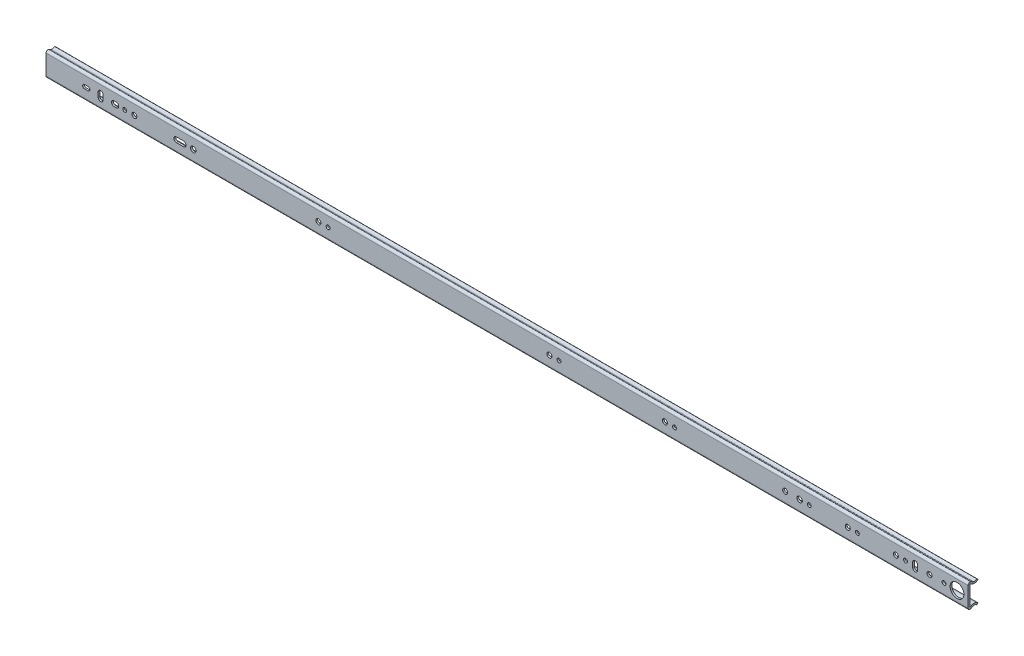
from build123d import *
from build123d.topology import SkipClean

# Parameters (mm, degrees)
EXTRUDE_THIN1_START     = -609.6
EXTRUDE_THIN1_DEPTH     = 1219.2
EXTRUDE_THIN2_DEPTH     = 1212.85
EXTRUDE_THIN5_START     = -1216.66
EXTRUDE_THIN5_DEPTH     = 1216.66
CUT_EXTRUDE1_DEPTH      = 1830.230661576
CUT_EXTRUDE1_DEPTH_BACK = 1830.230661576
SKETCH6_W               = 12.7
SKETCH6_H               = 12.7
SKETCH9_W               = 2.3622
SKETCH9_H               = 13.3858
EXTRUDE1_DEPTH          = 25.4
FILLET1_R               = 1.016
FILLET2_R               = 3.3782
CUT_EXTRUDE2_DEPTH      = 2.3622
SKETCH2_R               = 2.5781
SKETCH2_R_2             = 3.302
CUT_EXTRUDE12_DEPTH     = 2.3622
SKETCH22_R              = 2.5781
SKETCH22_R_2            = 3.302
SKETCH22_R_3            = 3.5687
CUT_EXTRUDE13_DEPTH     = 2.3622
SKETCH23_R              = 2.5781
SKETCH23_R_2            = 3.302
CUT_EXTRUDE14_DEPTH     = 2.3622
SKETCH24_R              = 2.5781
SKETCH24_R_2            = 3.302
CUT_EXTRUDE15_DEPTH     = 2.3622
SKETCH25_R              = 2.5781
SKETCH25_R_2            = 3.302
CUT_EXTRUDE16_DEPTH     = 2.3622
SKETCH27_R              = 3.5687
CUT_E_DEPTH             = 2.3622
SKETCH28_R              = 3.302
CUT_F_DEPTH             = 2.3622
SKETCH29_R              = 2.5781
CUT_EXTRUDE18_DEPTH     = 2.3622
CUT_H_DEPTH             = 2.3622
CUT_J_DEPTH             = 2.3622
SKETCH32_R              = 2.5781
SKETCH32_R_2            = 3.302
CUT_EXTRUDE21_DEPTH     = 2.3622
SKETCH210_R             = 2.5781
SKETCH210_R_2           = 3.302
CUT_EXTRUDE19_DEPTH     = 2.3622
SKETCH211_R             = 2.5781
SKETCH211_R_2           = 3.302
CUT_EXTRUDE110_DEPTH    = 2.3622
SKETCH212_R             = 2.5781
SKETCH212_R_2           = 3.302
CUT_EXTRUDE111_DEPTH    = 2.3622
SKETCH214_R             = 2.5781
SKETCH214_R_2           = 3.302
CUT_EXTRUDE113_DEPTH    = 2.3622
SKETCH215_R             = 3.302
CUT_EXTRUDE114_DEPTH    = 2.3622
CUT_R_DEPTH             = 2.3622
LPATTERN1_COUNT         = 23
LPATTERN1_PITCH         = 25.4
EXTRUDE2_DEPTH          = 12.7
EXTRUDE2_DEPTH_BACK     = 565.15
SKETCH218_W             = 11.43
SKETCH218_H             = 1.27
LPATTERN2_COUNT         = 23
LPATTERN2_PITCH         = 25.4
EXTRUDE3_DEPTH          = 12.7
EXTRUDE3_DEPTH_BACK     = 568.96
SKETCH220_W             = 9.245599771
SKETCH220_H             = 1.27


# Read off the part's stored shape, not the designer's step: Extrude-Thin1, Extrude-Thin5
with BuildPart() as part:
    # Extrude-Thin1 outline → Extrude-Thin1 (new body)
    with BuildSketch(Plane(origin=(0, 0, 0), x_dir=(0, 0, -1), z_dir=(1, 0, 0)).offset(EXTRUDE_THIN1_START)):
        with BuildLine():
            ThreePointArc((5.752462483, 35.334775085), (-0.647910774, 38.071449668), (-6.469678085, 34.255536805))
            Line((-6.469678085, 34.255536805), (-4.394919251, 33.126216382))
            ThreePointArc((-4.394919251, 33.126216382), (-0.440132491, 35.718405464), (3.907707273, 33.85935411))
            ThreePointArc((3.907707273, 33.85935411), (4.993998236, 32.994951487), (6.347544809, 32.686517335))
            Line((6.347544809, 32.686517335), (7.175193262, 32.686517335))
            ThreePointArc((7.175193262, 32.686517335), (8.297725277, 32.22154935), (8.762693262, 31.099017335))
            Line((8.762693262, 31.099017335), (8.762693262, 0))
            Line((8.762693262, 0), (11.124893262, 0))
            Line((11.124893262, 0), (11.124893262, 31.099017335))
            ThreePointArc((11.124893262, 31.099017335), (9.968052916, 33.891876989), (7.175193262, 35.048717335))
            Line((7.175193262, 35.048717335), (6.347544809, 35.048717335))
            ThreePointArc((6.347544809, 35.048717335), (6.017411498, 35.123945177), (5.752462483, 35.334775085))
        make_face()
    extrude(amount=EXTRUDE_THIN1_DEPTH)

    # Sketch6 → Cut-Extrude1 (cut, two sides: drawn at the far end of the back side and taken through both)
    with BuildSketch(Plane.XY.offset(-CUT_EXTRUDE1_DEPTH_BACK)):
        with Locations((-603.25, 31.75)):
            Rectangle(SKETCH6_W, SKETCH6_H)
    extrude(amount=CUT_EXTRUDE1_DEPTH + CUT_EXTRUDE1_DEPTH_BACK, mode=Mode.SUBTRACT)

    # Sketch9 → Extrude1 (add)
    with BuildSketch(Plane(origin=(0, 25.4, 0), x_dir=(-1, 0, 0), z_dir=(0, 1, 0))):
        with Locations((608.4189, -2.069793262)):
            Rectangle(SKETCH9_W, SKETCH9_H)
    extrude(amount=-EXTRUDE1_DEPTH)

    # Fillet1
    fillet1_edges = [part.edges().sort_by_distance(p)[0] for p in [
        (-607.2378, 12.7, -8.762693262),
    ]]
    fillet(fillet1_edges, radius=FILLET1_R)

    # Fillet2
    fillet2_edges = [part.edges().sort_by_distance(p)[0] for p in [
        (-609.6, 12.7, -11.124893262),
    ]]
    fillet(fillet2_edges, radius=FILLET2_R)

    # Sketch32 → Cut-Extrude21 (cut)
    with BuildSketch(Plane.XY.offset(-8.762693262)):
        with Locations((596.9, 0)):
            Circle(SKETCH32_R)
        with Locations((577.85, 0)):
            Circle(SKETCH32_R_2)
        with Locations((520.7, 0)):
            Circle(SKETCH32_R_2)
        with Locations((533.4, 0)):
            Circle(SKETCH32_R)
        with BuildLine():
            Line((549.148, 0), (561.848, 0))
            ThreePointArc((561.848, 0), (560.880866591, 2.334866591), (558.546, 3.302))
            Line((558.546, 3.302), (552.45, 3.302))
            ThreePointArc((552.45, 3.302), (550.115133409, 2.334866591), (549.148, 0))
        make_face()
    extrude(amount=-CUT_EXTRUDE21_DEPTH, mode=Mode.SUBTRACT)

    # Sketch210 → Cut-Extrude19 (cut)
    with BuildSketch(Plane(origin=(-677.249248887, 14.903736783, -8.762693262), x_dir=(1, 0, 0), z_dir=(0, 0, 1))):
        with Locations((1051.899248887, -14.903736783)):
            Circle(SKETCH210_R)
        with Locations((1039.199248887, -14.903736783)):
            Circle(SKETCH210_R_2)
    extrude(amount=-CUT_EXTRUDE19_DEPTH, mode=Mode.SUBTRACT)

    # Sketch211 → Cut-Extrude110 (cut)
    with BuildSketch(Plane(origin=(-447.985498291, 15.81613418, -8.762693262), x_dir=(1, 0, 0), z_dir=(0, 0, 1))):
        with Locations((460.685498291, -15.81613418)):
            Circle(SKETCH211_R)
        with Locations((447.985498291, -15.81613418)):
            Circle(SKETCH211_R_2)
    extrude(amount=-CUT_EXTRUDE110_DEPTH, mode=Mode.SUBTRACT)

    # Sketch212 → Cut-Extrude111 (cut)
    with BuildSketch(Plane(origin=(250.194594693, 14.477181682, -8.762693262), x_dir=(1, 0, 0), z_dir=(0, 0, 1))):
        with Locations((-599.444594693, -14.477181682)):
            Circle(SKETCH212_R)
        with Locations((-612.144594693, -14.477181682)):
            Circle(SKETCH212_R_2)
    extrude(amount=-CUT_EXTRUDE111_DEPTH, mode=Mode.SUBTRACT)

    # Sketch214 → Cut-Extrude113 (cut)
    with BuildSketch(Plane(origin=(529.798432462, 18.139402612, -8.762693262), x_dir=(1, 0, 0), z_dir=(0, 0, 1))):
        with Locations((-1066.500432462, -18.139402612)):
            Circle(SKETCH214_R)
        with Locations((-1079.200432462, -18.139402612)):
            Circle(SKETCH214_R_2)
        with BuildLine():
            Line((-1044.148432462, -18.139402612), (-1056.848432462, -18.139402612))
            ThreePointArc((-1056.848432462, -18.139402612), (-1055.881299054, -15.80453602), (-1053.546432462, -14.837402612))
            Line((-1053.546432462, -14.837402612), (-1047.450432462, -14.837402612))
            ThreePointArc((-1047.450432462, -14.837402612), (-1045.115565871, -15.80453602), (-1044.148432462, -18.139402612))
        make_face()
    extrude(amount=-CUT_EXTRUDE113_DEPTH, mode=Mode.SUBTRACT)

    # Sketch215 → Cut-Extrude114 (cut)
    with BuildSketch(Plane(origin=(674.3557152, 11.320285871, -8.762693262), x_dir=(1, 0, 0), z_dir=(0, 0, 1))):
        with Locations((-1252.2057152, -11.320285871)):
            Circle(SKETCH215_R)
    extrude(amount=-CUT_EXTRUDE114_DEPTH, mode=Mode.SUBTRACT)

    # Sketch216 → Cut R (cut)
    with BuildSketch(Plane.XY.offset(-8.762693262)):
        with BuildLine():
            Line((-601.6625, 0), (-592.1375, 0))
            ThreePointArc((-592.1375, 0), (-592.892608007, 1.822991993), (-594.7156, 2.5781))
            Line((-594.7156, 2.5781), (-599.0844, 2.5781))
            ThreePointArc((-599.0844, 2.5781), (-600.907391993, 1.822991993), (-601.6625, 0))
        make_face()
    extrude(amount=-CUT_R_DEPTH, mode=Mode.SUBTRACT)

    # Mirror1 3: part across plane


with BuildPart() as body_2:
    # Sketch4 → Extrude-Thin2 (new body)
    with BuildSketch(Plane(origin=(1219.2, 0, 0), x_dir=(0, 0, -1), z_dir=(1, 0, 0))):
        with BuildLine():
            ThreePointArc((3.54024831, 19.789205828), (0.77024158, 21.457292879), (-2.36668079, 20.672965307))
            ThreePointArc((-2.36668079, 20.672965307), (-3.091811244, 20.294053258), (-3.898522237, 20.157649845))
            ThreePointArc((-3.898522237, 20.157649845), (-5.766174756, 20.914093138), (-6.542172842, 22.773705828))
            Line((-6.542172842, 22.773705828), (-6.542172842, 25.161305828))
            ThreePointArc((-6.542172842, 25.161305828), (-5.766174756, 27.020918518), (-3.898522237, 27.77736181))
            ThreePointArc((-3.898522237, 27.77736181), (-3.659975019, 27.729624759), (-3.455361804, 27.598030559))
            ThreePointArc((-3.455361804, 27.598030559), (-0.023095262, 26.226172038), (3.414460302, 27.584723163))
            ThreePointArc((3.414460302, 27.584723163), (6.244879756, 28.080225918), (7.822893148, 25.678836527))
            Line((7.822893148, 25.678836527), (7.822893148, 11.408756936))
            ThreePointArc((7.822893148, 11.408756936), (7.431553352, 9.948256936), (6.362393148, 8.879096732))
            Line((6.362393148, 8.879096732), (3.123893148, 7.009347885))
            ThreePointArc((3.123893148, 7.009347885), (2.84498179, 6.730436527), (2.742893148, 6.349436527))
            Line((2.742893148, 6.349436527), (2.742893148, 0))
            Line((2.742893148, 0), (0.583893148, 0))
            Line((0.583893148, 0), (0.583893148, 6.349436527))
            ThreePointArc((0.583893148, 6.349436527), (0.975232943, 7.809936527), (2.044393148, 8.879096732))
            Line((2.044393148, 8.879096732), (5.282893148, 10.748845578))
            ThreePointArc((5.282893148, 10.748845578), (5.561804505, 11.027756936), (5.663893148, 11.408756936))
            Line((5.663893148, 11.408756936), (5.663893148, 25.678836527))
            ThreePointArc((5.663893148, 25.678836527), (5.388123817, 26.098496809), (4.893487408, 26.011904095))
            ThreePointArc((4.893487408, 26.011904095), (0.412345154, 24.079826794), (-4.266408016, 25.466487303))
            ThreePointArc((-4.266408016, 25.466487303), (-4.352985021, 25.324684037), (-4.383172842, 25.161305828))
            Line((-4.383172842, 25.161305828), (-4.383172842, 22.773705828))
            ThreePointArc((-4.383172842, 22.773705828), (-4.247561526, 22.448724969), (-3.921175649, 22.316530996))
            ThreePointArc((-3.921175649, 22.316530996), (-3.780197029, 22.340368486), (-3.653475202, 22.406586125))
            ThreePointArc((-3.653475202, 22.406586125), (1.089702598, 23.592527212), (5.278086268, 21.070299201))
            Line((5.278086268, 21.070299201), (3.54024831, 19.789205828))
        make_face()
    extrude(amount=-EXTRUDE_THIN2_DEPTH)

    # Mirror1: body 2 across plane


with BuildPart() as body_3:
    # Extrude-Thin5 outline → Extrude-Thin5 (new body)
    with BuildSketch(Plane(origin=(1828.8, 0, 0), x_dir=(0, 0, -1), z_dir=(1, 0, 0)).offset(EXTRUDE_THIN5_START)):
        with BuildLine():
            Line((-7.925106738, 0), (-5.562906738, 0))
            Line((-5.562906738, 0), (-5.562906738, 13.036209579))
            ThreePointArc((-5.562906738, 13.036209579), (-5.437890097, 13.255022954), (-5.185904431, 13.258440163))
            Line((-5.185904431, 13.258440163), (-2.932066495, 12.010964405))
            ThreePointArc((-2.932066495, 12.010964405), (1.369676528, 11.28348431), (5.180595526, 13.407423274))
            Line((5.180595526, 13.407423274), (3.41147618, 14.972736527))
            ThreePointArc((3.41147618, 14.972736527), (0.968956668, 13.611447462), (-1.788145038, 14.077708835))
            Line((-1.788145038, 14.077708835), (-4.041982973, 15.325184593))
            ThreePointArc((-4.041982973, 15.325184593), (-6.637435339, 15.28998734), (-7.925106738, 13.036209579))
            Line((-7.925106738, 13.036209579), (-7.925106738, 0))
        make_face()
    extrude(amount=EXTRUDE_THIN5_DEPTH)

    # Sketch10 → Cut-Extrude2 (cut)
    with BuildSketch(Plane.XY.offset(7.925106738)):
        with BuildLine():
            Line((1805.07005, 0), (1823.35805, 0))
            ThreePointArc((1823.35805, 0), (1814.21405, 9.144), (1805.07005, 0))
        make_face()
        with BuildLine():
            Line((1799.6281, 0), (1794.4719, 0))
            ThreePointArc((1794.4719, 0), (1797.05, 2.5781), (1799.6281, 0))
        make_face()
        with BuildLine():
            Line((1781.302, 0), (1774.698, 0))
            ThreePointArc((1774.698, 0), (1778, 3.302), (1781.302, 0))
        make_face()
        with BuildLine():
            Line((1762.252, 3.048), (1762.252, 0))
            Line((1762.252, 0), (1755.648, 0))
            Line((1755.648, 0), (1755.648, 3.048))
            ThreePointArc((1755.648, 3.048), (1758.95, 6.35), (1762.252, 3.048))
        make_face()
        with BuildLine():
            Line((1748.8281, 0), (1743.6719, 0))
            ThreePointArc((1743.6719, 0), (1746.25, 2.5781), (1748.8281, 0))
        make_face()
        with BuildLine():
            Line((1736.852, 0), (1730.248, 0))
            ThreePointArc((1730.248, 0), (1733.55, 3.302), (1736.852, 0))
        make_face()
    extrude(amount=-CUT_EXTRUDE2_DEPTH, mode=Mode.SUBTRACT)

    # Sketch2 → Cut-Extrude12 (cut)
    with BuildSketch(Plane(origin=(-2141.845428582, 6.157941778, 7.925106738), x_dir=(1, 0, 0), z_dir=(0, 0, 1))):
        with Locations((3824.595428582, -6.157941778)):
            Circle(SKETCH2_R)
        with Locations((3811.895428582, -6.157941778)):
            Circle(SKETCH2_R_2)
    extrude(amount=-CUT_EXTRUDE12_DEPTH, mode=Mode.SUBTRACT)

    # Sketch22 → Cut-Extrude13 (cut)
    with BuildSketch(Plane(origin=(-2143.135428603, 5.657950018, 7.925106738), x_dir=(1, 0, 0), z_dir=(0, 0, 1))):
        with Locations((3762.385428603, -5.657950018)):
            Circle(SKETCH22_R)
        with Locations((3730.635428603, -5.657950018)):
            Circle(SKETCH22_R_2)
        with Locations((3749.685428603, -5.657950018)):
            Circle(SKETCH22_R_3)
    extrude(amount=-CUT_EXTRUDE13_DEPTH, mode=Mode.SUBTRACT)

    # Sketch23 → Cut-Extrude14 (cut)
    with BuildSketch(Plane(origin=(-2022.429166167, 5.760053708, 7.925106738), x_dir=(1, 0, 0), z_dir=(0, 0, 1))):
        with Locations((3463.879166167, -5.760053708)):
            Circle(SKETCH23_R)
        with Locations((3451.179166167, -5.760053708)):
            Circle(SKETCH23_R_2)
    extrude(amount=-CUT_EXTRUDE14_DEPTH, mode=Mode.SUBTRACT)

    # Sketch24 → Cut-Extrude15 (cut)
    with BuildSketch(Plane(origin=(-1862.330020924, 7.905664942, 7.925106738), x_dir=(1, 0, 0), z_dir=(0, 0, 1))):
        with Locations((3151.380020924, -7.905664942)):
            Circle(SKETCH24_R)
        with Locations((3138.680020924, -7.905664942)):
            Circle(SKETCH24_R_2)
    extrude(amount=-CUT_EXTRUDE15_DEPTH, mode=Mode.SUBTRACT)

    # Sketch25 → Cut-Extrude16 (cut)
    with BuildSketch(Plane(origin=(-1718.369763818, 7.737387679, 7.925106738), x_dir=(1, 0, 0), z_dir=(0, 0, 1))):
        with Locations((2702.619763818, -7.737387679)):
            Circle(SKETCH25_R)
        with Locations((2689.919763818, -7.737387679)):
            Circle(SKETCH25_R_2)
    extrude(amount=-CUT_EXTRUDE16_DEPTH, mode=Mode.SUBTRACT)

    # Sketch27 → Cut E (cut)
    with BuildSketch(Plane.XY.offset(7.925106738)):
        with Locations((806.45, 0)):
            Circle(SKETCH27_R)
        with BuildLine():
            Line((796.8615, 0), (780.9865, 0))
            ThreePointArc((780.9865, 0), (781.953633409, 2.334866591), (784.2885, 3.302))
            Line((784.2885, 3.302), (793.5595, 3.302))
            ThreePointArc((793.5595, 3.302), (795.894366591, 2.334866591), (796.8615, 0))
        make_face()
    extrude(amount=-CUT_E_DEPTH, mode=Mode.SUBTRACT)

    # Sketch28 → Cut F (cut)
    with BuildSketch(Plane.XY.offset(7.925106738)):
        with Locations((728.726, 0)):
            Circle(SKETCH28_R)
    extrude(amount=-CUT_F_DEPTH, mode=Mode.SUBTRACT)

    # Sketch29 → Cut-Extrude18 (cut)
    with BuildSketch(Plane(origin=(-866.129297637, 5.417355799, 7.925106738), x_dir=(1, 0, 0), z_dir=(0, 0, 1))):
        with Locations((1582.155297637, -5.417355799)):
            Circle(SKETCH29_R)
        with BuildLine():
            Line((1574.217797637, -5.417355799), (1564.692797637, -5.417355799))
            ThreePointArc((1564.692797637, -5.417355799), (1565.659931046, -3.082489207), (1567.994797637, -2.115355799))
            Line((1567.994797637, -2.115355799), (1570.915797637, -2.115355799))
            ThreePointArc((1570.915797637, -2.115355799), (1573.250664228, -3.082489207), (1574.217797637, -5.417355799))
        make_face()
    extrude(amount=-CUT_EXTRUDE18_DEPTH, mode=Mode.SUBTRACT)

    # Sketch30 → Cut H (cut)
    with BuildSketch(Plane.XY.offset(7.925106738)):
        with BuildLine():
            Line((680.974, 0), (680.974, 3.048))
            ThreePointArc((680.974, 3.048), (684.276, 6.35), (687.578, 3.048))
            Line((687.578, 3.048), (687.578, 0))
            Line((687.578, 0), (680.974, 0))
        make_face()
    extrude(amount=-CUT_H_DEPTH, mode=Mode.SUBTRACT)

    # Sketch31 → Cut J (cut)
    with BuildSketch(Plane.XY.offset(7.925106738)):
        with BuildLine():
            Line((669.9885, 0), (660.4635, 0))
            ThreePointArc((660.4635, 0), (661.218608007, 1.822991993), (663.0416, 2.5781))
            Line((663.0416, 2.5781), (667.4104, 2.5781))
            ThreePointArc((667.4104, 2.5781), (669.233391993, 1.822991993), (669.9885, 0))
        make_face()
    extrude(amount=-CUT_J_DEPTH, mode=Mode.SUBTRACT)

    # Mirror1 2: body 3 across plane


with BuildPart() as body_2_1:
    add(body_2.part)
    add(body_2.part.mirror(Plane.ZX))


with BuildPart() as body_3_1:
    with SkipClean():  # the faces are left unmerged after this step: merging them gives an invalid solid
        add(body_3.part)
        add(body_3.part.mirror(Plane.ZX))


with BuildPart() as part_1:
    with SkipClean():  # the faces are left unmerged after this step: merging them gives an invalid solid
        add(part.part)
        add(part.part.mirror(Plane.ZX))


with BuildPart() as body_4:
    # Sketch217 → Revolve1 (revolve)
    with BuildSketch(Plane(origin=(584.2, 0, 0), x_dir=(0, 0, -1), z_dir=(1, 0, 0))):
        with BuildLine():
            Line((0, 35.7378), (0, 26.22652483))
            ThreePointArc((0, 26.22652483), (4.755637585, 30.982162415), (0, 35.7378))
        make_face()
    revolve(axis=Axis((584.2, 36.603094088, 0), (0, -1, 0)))


with BuildPart() as lpattern1_1:
    # LPattern1: pattern copy
    add(body_4.part.moved(Location(Vector(-1, 0, 0) * (1 * LPATTERN1_PITCH))))


with BuildPart() as lpattern1_2:
    # LPattern1: pattern copy
    add(body_4.part.moved(Location(Vector(-1, 0, 0) * (2 * LPATTERN1_PITCH))))


with BuildPart() as lpattern1_3:
    # LPattern1: pattern copy
    add(body_4.part.moved(Location(Vector(-1, 0, 0) * (3 * LPATTERN1_PITCH))))


with BuildPart() as lpattern1_4:
    # LPattern1: pattern copy
    add(body_4.part.moved(Location(Vector(-1, 0, 0) * (4 * LPATTERN1_PITCH))))


with BuildPart() as lpattern1_5:
    # LPattern1: pattern copy
    add(body_4.part.moved(Location(Vector(-1, 0, 0) * (5 * LPATTERN1_PITCH))))


with BuildPart() as lpattern1_6:
    # LPattern1: pattern copy
    add(body_4.part.moved(Location(Vector(-1, 0, 0) * (6 * LPATTERN1_PITCH))))


with BuildPart() as lpattern1_7:
    # LPattern1: pattern copy
    add(body_4.part.moved(Location(Vector(-1, 0, 0) * (7 * LPATTERN1_PITCH))))


with BuildPart() as lpattern1_8:
    # LPattern1: pattern copy
    add(body_4.part.moved(Location(Vector(-1, 0, 0) * (8 * LPATTERN1_PITCH))))


with BuildPart() as lpattern1_9:
    # LPattern1: pattern copy
    add(body_4.part.moved(Location(Vector(-1, 0, 0) * (9 * LPATTERN1_PITCH))))


with BuildPart() as lpattern1_10:
    # LPattern1: pattern copy
    add(body_4.part.moved(Location(Vector(-1, 0, 0) * (10 * LPATTERN1_PITCH))))


with BuildPart() as lpattern1_11:
    # LPattern1: pattern copy
    add(body_4.part.moved(Location(Vector(-1, 0, 0) * (11 * LPATTERN1_PITCH))))


with BuildPart() as lpattern1_12:
    # LPattern1: pattern copy
    add(body_4.part.moved(Location(Vector(-1, 0, 0) * (12 * LPATTERN1_PITCH))))


with BuildPart() as lpattern1_13:
    # LPattern1: pattern copy
    add(body_4.part.moved(Location(Vector(-1, 0, 0) * (13 * LPATTERN1_PITCH))))


with BuildPart() as lpattern1_14:
    # LPattern1: pattern copy
    add(body_4.part.moved(Location(Vector(-1, 0, 0) * (14 * LPATTERN1_PITCH))))


with BuildPart() as lpattern1_15:
    # LPattern1: pattern copy
    add(body_4.part.moved(Location(Vector(-1, 0, 0) * (15 * LPATTERN1_PITCH))))


with BuildPart() as lpattern1_16:
    # LPattern1: pattern copy
    add(body_4.part.moved(Location(Vector(-1, 0, 0) * (16 * LPATTERN1_PITCH))))


with BuildPart() as lpattern1_17:
    # LPattern1: pattern copy
    add(body_4.part.moved(Location(Vector(-1, 0, 0) * (17 * LPATTERN1_PITCH))))


with BuildPart() as lpattern1_18:
    # LPattern1: pattern copy
    add(body_4.part.moved(Location(Vector(-1, 0, 0) * (18 * LPATTERN1_PITCH))))


with BuildPart() as lpattern1_19:
    # LPattern1: pattern copy
    add(body_4.part.moved(Location(Vector(-1, 0, 0) * (19 * LPATTERN1_PITCH))))


with BuildPart() as lpattern1_20:
    # LPattern1: pattern copy
    add(body_4.part.moved(Location(Vector(-1, 0, 0) * (20 * LPATTERN1_PITCH))))


with BuildPart() as lpattern1_21:
    # LPattern1: pattern copy
    add(body_4.part.moved(Location(Vector(-1, 0, 0) * (21 * LPATTERN1_PITCH))))


with BuildPart() as lpattern1_22:
    # LPattern1: pattern copy
    add(body_4.part.moved(Location(Vector(-1, 0, 0) * (22 * LPATTERN1_PITCH))))


with BuildPart() as body_4_1:
    add(body_4.part)

    add(lpattern1_1.part)  # Extrude2 merges LPattern1_1

    add(lpattern1_2.part)  # Extrude2 merges LPattern1_2

    add(lpattern1_3.part)  # Extrude2 merges LPattern1_3

    add(lpattern1_4.part)  # Extrude2 merges LPattern1_4

    add(lpattern1_5.part)  # Extrude2 merges LPattern1_5

    add(lpattern1_6.part)  # Extrude2 merges LPattern1_6

    add(lpattern1_7.part)  # Extrude2 merges LPattern1_7

    add(lpattern1_8.part)  # Extrude2 merges LPattern1_8

    add(lpattern1_9.part)  # Extrude2 merges LPattern1_9

    add(lpattern1_10.part)  # Extrude2 merges LPattern1_10

    add(lpattern1_11.part)  # Extrude2 merges LPattern1_11

    add(lpattern1_12.part)  # Extrude2 merges LPattern1_12

    add(lpattern1_13.part)  # Extrude2 merges LPattern1_13

    add(lpattern1_14.part)  # Extrude2 merges LPattern1_14

    add(lpattern1_15.part)  # Extrude2 merges LPattern1_15

    add(lpattern1_16.part)  # Extrude2 merges LPattern1_16

    add(lpattern1_17.part)  # Extrude2 merges LPattern1_17

    add(lpattern1_18.part)  # Extrude2 merges LPattern1_18

    add(lpattern1_19.part)  # Extrude2 merges LPattern1_19

    add(lpattern1_20.part)  # Extrude2 merges LPattern1_20

    add(lpattern1_21.part)  # Extrude2 merges LPattern1_21

    add(lpattern1_22.part)  # Extrude2 merges LPattern1_22
    # Sketch218 → Extrude2 (add, two sides: drawn at the far end of the back side and taken through both)
    with BuildSketch(Plane(origin=(584.2, 0, 0), x_dir=(0, 0, -1), z_dir=(1, 0, 0)).offset(-EXTRUDE2_DEPTH_BACK)):
        with Locations((0, 30.9753)):
            Rectangle(SKETCH218_W, SKETCH218_H)
    extrude(amount=EXTRUDE2_DEPTH + EXTRUDE2_DEPTH_BACK)


with BuildPart() as body_5:
    # Sketch219 → Revolve2 (revolve)
    with BuildSketch(Plane(origin=(1193.8, 0, 0), x_dir=(0, 0, -1), z_dir=(1, 0, 0))):
        with BuildLine():
            Line((-0.000306852, 21.487836527), (-0.000306852, 13.550336527))
            ThreePointArc((-0.000306852, 13.550336527), (3.968443148, 17.519086527), (-0.000306852, 21.487836527))
        make_face()
    revolve(axis=Axis((1193.8, 22.284965157, 0.000306852), (0, -1, 0)))


with BuildPart() as lpattern2_1:
    # LPattern2: pattern copy
    add(body_5.part.moved(Location(Vector(-1, 0, 0) * (1 * LPATTERN2_PITCH))))


with BuildPart() as lpattern2_2:
    # LPattern2: pattern copy
    add(body_5.part.moved(Location(Vector(-1, 0, 0) * (2 * LPATTERN2_PITCH))))


with BuildPart() as lpattern2_3:
    # LPattern2: pattern copy
    add(body_5.part.moved(Location(Vector(-1, 0, 0) * (3 * LPATTERN2_PITCH))))


with BuildPart() as lpattern2_4:
    # LPattern2: pattern copy
    add(body_5.part.moved(Location(Vector(-1, 0, 0) * (4 * LPATTERN2_PITCH))))


with BuildPart() as lpattern2_5:
    # LPattern2: pattern copy
    add(body_5.part.moved(Location(Vector(-1, 0, 0) * (5 * LPATTERN2_PITCH))))


with BuildPart() as lpattern2_6:
    # LPattern2: pattern copy
    add(body_5.part.moved(Location(Vector(-1, 0, 0) * (6 * LPATTERN2_PITCH))))


with BuildPart() as lpattern2_7:
    # LPattern2: pattern copy
    add(body_5.part.moved(Location(Vector(-1, 0, 0) * (7 * LPATTERN2_PITCH))))


with BuildPart() as lpattern2_8:
    # LPattern2: pattern copy
    add(body_5.part.moved(Location(Vector(-1, 0, 0) * (8 * LPATTERN2_PITCH))))


with BuildPart() as lpattern2_9:
    # LPattern2: pattern copy
    add(body_5.part.moved(Location(Vector(-1, 0, 0) * (9 * LPATTERN2_PITCH))))


with BuildPart() as lpattern2_10:
    # LPattern2: pattern copy
    add(body_5.part.moved(Location(Vector(-1, 0, 0) * (10 * LPATTERN2_PITCH))))


with BuildPart() as lpattern2_11:
    # LPattern2: pattern copy
    add(body_5.part.moved(Location(Vector(-1, 0, 0) * (11 * LPATTERN2_PITCH))))


with BuildPart() as lpattern2_12:
    # LPattern2: pattern copy
    add(body_5.part.moved(Location(Vector(-1, 0, 0) * (12 * LPATTERN2_PITCH))))


with BuildPart() as lpattern2_13:
    # LPattern2: pattern copy
    add(body_5.part.moved(Location(Vector(-1, 0, 0) * (13 * LPATTERN2_PITCH))))


with BuildPart() as lpattern2_14:
    # LPattern2: pattern copy
    add(body_5.part.moved(Location(Vector(-1, 0, 0) * (14 * LPATTERN2_PITCH))))


with BuildPart() as lpattern2_15:
    # LPattern2: pattern copy
    add(body_5.part.moved(Location(Vector(-1, 0, 0) * (15 * LPATTERN2_PITCH))))


with BuildPart() as lpattern2_16:
    # LPattern2: pattern copy
    add(body_5.part.moved(Location(Vector(-1, 0, 0) * (16 * LPATTERN2_PITCH))))


with BuildPart() as lpattern2_17:
    # LPattern2: pattern copy
    add(body_5.part.moved(Location(Vector(-1, 0, 0) * (17 * LPATTERN2_PITCH))))


with BuildPart() as lpattern2_18:
    # LPattern2: pattern copy
    add(body_5.part.moved(Location(Vector(-1, 0, 0) * (18 * LPATTERN2_PITCH))))


with BuildPart() as lpattern2_19:
    # LPattern2: pattern copy
    add(body_5.part.moved(Location(Vector(-1, 0, 0) * (19 * LPATTERN2_PITCH))))


with BuildPart() as lpattern2_20:
    # LPattern2: pattern copy
    add(body_5.part.moved(Location(Vector(-1, 0, 0) * (20 * LPATTERN2_PITCH))))


with BuildPart() as lpattern2_21:
    # LPattern2: pattern copy
    add(body_5.part.moved(Location(Vector(-1, 0, 0) * (21 * LPATTERN2_PITCH))))


with BuildPart() as lpattern2_22:
    # LPattern2: pattern copy
    add(body_5.part.moved(Location(Vector(-1, 0, 0) * (22 * LPATTERN2_PITCH))))


with BuildPart() as body_5_1:
    add(body_5.part)

    add(lpattern2_1.part)  # Extrude3 merges LPattern2_1

    add(lpattern2_2.part)  # Extrude3 merges LPattern2_2

    add(lpattern2_3.part)  # Extrude3 merges LPattern2_3

    add(lpattern2_4.part)  # Extrude3 merges LPattern2_4

    add(lpattern2_5.part)  # Extrude3 merges LPattern2_5

    add(lpattern2_6.part)  # Extrude3 merges LPattern2_6

    add(lpattern2_7.part)  # Extrude3 merges LPattern2_7

    add(lpattern2_8.part)  # Extrude3 merges LPattern2_8

    add(lpattern2_9.part)  # Extrude3 merges LPattern2_9

    add(lpattern2_10.part)  # Extrude3 merges LPattern2_10

    add(lpattern2_11.part)  # Extrude3 merges LPattern2_11

    add(lpattern2_12.part)  # Extrude3 merges LPattern2_12

    add(lpattern2_13.part)  # Extrude3 merges LPattern2_13

    add(lpattern2_14.part)  # Extrude3 merges LPattern2_14

    add(lpattern2_15.part)  # Extrude3 merges LPattern2_15

    add(lpattern2_16.part)  # Extrude3 merges LPattern2_16

    add(lpattern2_17.part)  # Extrude3 merges LPattern2_17

    add(lpattern2_18.part)  # Extrude3 merges LPattern2_18

    add(lpattern2_19.part)  # Extrude3 merges LPattern2_19

    add(lpattern2_20.part)  # Extrude3 merges LPattern2_20

    add(lpattern2_21.part)  # Extrude3 merges LPattern2_21

    add(lpattern2_22.part)  # Extrude3 merges LPattern2_22
    # Sketch220 → Extrude3 (add, two sides: drawn at the far end of the back side and taken through both)
    with BuildSketch(Plane(origin=(1193.8, 0, 0), x_dir=(0, 0, -1), z_dir=(1, 0, 0)).offset(-EXTRUDE3_DEPTH_BACK)):
        with Locations((-0.000306853, 17.519086527)):
            Rectangle(SKETCH220_W, SKETCH220_H)
    extrude(amount=EXTRUDE3_DEPTH + EXTRUDE3_DEPTH_BACK)


with BuildPart() as body_6:
    # Mirror3: mirrored copy
    add(body_4_1.part.mirror(Plane.ZX))


with BuildPart() as body_7:
    # Mirror3 2: mirrored copy
    add(body_5_1.part.mirror(Plane.ZX))


solid = body_3_1.part
